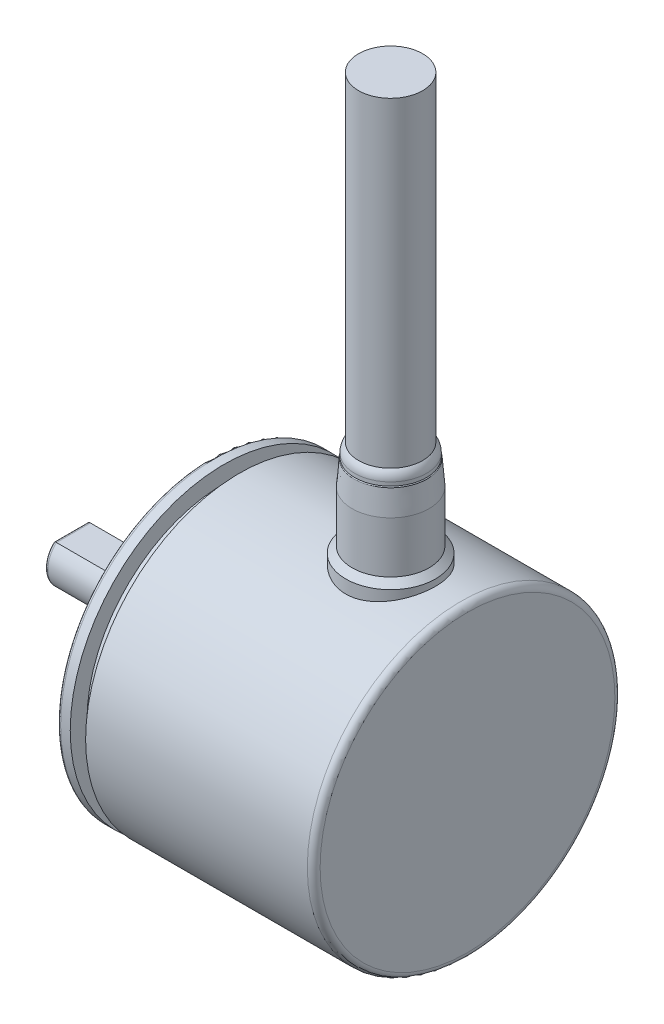
from build123d import *

# Parameters (mm, degrees)
ESQUISSE2_R             = 3.5
BOSS_EXTRU_1_DEPTH      = 13
ESQUISSE3_R             = 3
BOSS_EXTRU_2_DEPTH      = 6
ESQUISSE4_R             = 2.8
BOSS_EXTRU_3_DEPTH      = 1
ESQUISSE5_R             = 2.5
BOSS_EXTRU_4_DEPTH      = 25
CHANFREIN1_SIZE         = 0.5
CHANFREIN2_SIZE         = 2
CHANFREIN2_SIZE2        = 0.16
CONG_1_R                = 1
CONG_2_R                = 0.1
ENL_V_MAT_EXTRU_2_DEPTH = 8.5
CONG_3_R                = 0.5
CONG_4_R                = 0.25
CONG_5_R                = 0.25
ESQUISSE9_R             = 5
ESQUISSE9_R_2           = 4
ESQUISSE9_R_3           = 3
ESQUISSE9_R_4           = 2
ENL_V_MAT_EXTRU_4_DEPTH = 0.25
ESQUISSE10_R            = 4
ESQUISSE10_R_2          = 3
ENL_V_MAT_EXTRU_5_DEPTH = 0.5
CONG_6_R                = 0.125
ESQUISSE8_R             = 1.5
ENL_V_MAT_EXTRU_3_DEPTH = 6


# Some blends are built 0.0001 mm under size
with BuildPart() as part:
    # Esquisse1 → Révolution1 (revolve)
    with BuildSketch(Plane(origin=(0, 0, 0), x_dir=(1, 0, 0), z_dir=(0, 1, 0)), mode=Mode.PRIVATE) as r_volution1_sk:
        Polygon((12, 10.7), (12, 12), (11, 12), (11, 6), (10, 6), (10, 2), (0, 2), (0, 0), (31, 0), (31, 12), (13.2, 12), (13.2, 10.7), align=None)
    revolve(r_volution1_sk.sketch.rotate(Axis((0, 0, 0), (1, 0, 0)), 180), axis=Axis((0, 0, 0), (1, 0, 0)))

    # Esquisse2 → Boss.-Extru.1 (add)
    with BuildSketch(Plane(origin=(0, 0, 0), x_dir=(1, 0, 0), z_dir=(0, 1, 0))):
        with Locations(Location((25, 0, 0), (0, 0, 90))):
            Circle(ESQUISSE2_R)
    extrude(amount=BOSS_EXTRU_1_DEPTH)

    # Esquisse3 → Boss.-Extru.2 (add)
    with BuildSketch(Plane(origin=(0, 13, 0), x_dir=(1, 0, 0), z_dir=(0, 1, 0))):
        with Locations(Location((25, 0, 0), (0, 0, 270))):
            Circle(ESQUISSE3_R)
    extrude(amount=BOSS_EXTRU_2_DEPTH)

    # Esquisse4 → Boss.-Extru.3 (add)
    with BuildSketch(Plane(origin=(0, 19, 0), x_dir=(1, 0, 0), z_dir=(0, 1, 0))):
        with Locations(Location((25, 0, 0), (0, 0, 270))):
            Circle(ESQUISSE4_R)
    extrude(amount=BOSS_EXTRU_3_DEPTH)

    # Esquisse5 → Boss.-Extru.4 (add)
    with BuildSketch(Plane(origin=(0, 20, 0), x_dir=(1, 0, 0), z_dir=(0, 1, 0))):
        with Locations(Location((25, 0, 0), (0, 0, 270))):
            Circle(ESQUISSE5_R)
    extrude(amount=BOSS_EXTRU_4_DEPTH)

    # Chanfrein1
    chanfrein1_edges = [part.edges().sort_by_distance(p)[0] for p in [
        (25, 13, 3.5),
    ]]
    chamfer(chanfrein1_edges, length=CHANFREIN1_SIZE - 0.0001)  # a hair under: the kernel refuses the full size

    # Chanfrein2
    chanfrein2_edges = [part.edges().sort_by_distance(p)[0] for p in [
        (25, 19, -3),
    ]]
    chanfrein2_side = [part.faces().sort_by_distance(p)[0] for p in [
        (25, 16, -3),
    ]]
    chamfer(chanfrein2_edges, length=CHANFREIN2_SIZE, length2=CHANFREIN2_SIZE2, reference=chanfrein2_side[0])

    # Congé1
    # the kernel refuses this fillet: 1 mm, written as the material it takes off along each edge
    with BuildSketch(Plane(origin=(25, 20, 0), x_dir=(0, 0, 1), z_dir=(-1, 0, 0))) as cong_1_piece_1:
        with BuildLine():
            CenterArc((1.8, -0.714142843), CONG_1_R, 0, 45.572995999)
            Line((2.5, 0), (2.514, 0.014282857))
            ThreePointArc((2.514, 0.014282857), (2.65, 0.02), (2.8, 0.02))
            Line((2.8, 0.02), (2.82, 0))
            Line((2.82, 0), (2.82, -0.714142843))
            Line((2.82, -0.714142843), (2.8, -0.714142843))
        make_face()
    revolve(axis=Axis((25, 20, 0), (0, 1, 0)), mode=Mode.SUBTRACT)

    # Congé2
    # the kernel refuses this fillet: 0.1 mm, written as the material it takes off along each edge
    with BuildSketch(Plane(origin=(25, 19, 0), x_dir=(0, 0, 1), z_dir=(-1, 0, 0))) as cong_2_piece_1:
        with BuildLine():
            CenterArc((2.746436086, -0.084444699), CONG_2_R, 4.57392126, 53.038812221)
            Line((2.8, 0), (2.801071278, 0.001688894))
            ThreePointArc((2.801071278, 0.001688894), (2.82, 0.002), (2.84, 0.002))
            Line((2.84, 0.002), (2.841993631, 0.00015949))
            Line((2.841993631, 0.00015949), (2.848111245, -0.076310686))
            Line((2.848111245, -0.076310686), (2.846117614, -0.076470177))
        make_face()
    revolve(axis=Axis((25, 19, 0), (0, 1, 0)), mode=Mode.SUBTRACT)

    # Esquisse7 → Enlèv. mat.-Extru.2 (cut)
    with BuildSketch(Plane.ZY):
        with BuildLine():
            Line((-1.322875656, 1.5), (1.322875656, 1.5))
            ThreePointArc((1.322875656, 1.5), (0, 2), (-1.322875656, 1.5))
        make_face()
    extrude(amount=-ENL_V_MAT_EXTRU_2_DEPTH, mode=Mode.SUBTRACT)

    # Congé3
    cong_3_edges = [part.edges().sort_by_distance(p)[0] for p in [
        (31, 0, -12),
    ]]
    fillet(cong_3_edges, radius=CONG_3_R)

    # Congé4
    cong_4_edges = [part.edges().sort_by_distance(p)[0] for p in [
        (11, 0, -12),
        (10, 0, -6),
    ]]
    fillet(cong_4_edges, radius=CONG_4_R)

    # Congé5
    cong_5_edges = [part.edges().sort_by_distance(p)[0] for p in [
        (0, -1.822875656, -0.822875656),
        (0, 1.5, 0),
    ]]
    fillet(cong_5_edges, radius=CONG_5_R)

    # Esquisse9 → Enlèv. mat.-Extru.4 (cut)
    # profile 1 of 2: a face of its own
    with BuildSketch(Plane.ZY.offset(-10)):
        Circle(ESQUISSE9_R)
        Circle(ESQUISSE9_R_2, mode=Mode.SUBTRACT)
    # profile 2 of 2: a face of its own
    with BuildSketch(Plane.ZY.offset(-10)):
        Circle(ESQUISSE9_R_3)
        Circle(ESQUISSE9_R_4, mode=Mode.SUBTRACT)
    extrude(amount=-ENL_V_MAT_EXTRU_4_DEPTH, mode=Mode.SUBTRACT)

    # Esquisse10 → Enlèv. mat.-Extru.5 (cut)
    with BuildSketch(Plane.ZY.offset(-10)):
        Circle(ESQUISSE10_R)
        Circle(ESQUISSE10_R_2, mode=Mode.SUBTRACT)
    extrude(amount=-ENL_V_MAT_EXTRU_5_DEPTH, mode=Mode.SUBTRACT)

    # Congé6
    cong_6_edges = [part.edges().sort_by_distance(p)[0] for p in [
        (10.25, 0, -4),
        (10.25, 0, -3),
    ]]
    fillet(cong_6_edges, radius=CONG_6_R)

    # Esquisse8 → Enlèv. mat.-Extru.3 (cut)
    with BuildSketch(Plane.ZY.offset(-11)):
        with Locations((0, 9)):
            Circle(ESQUISSE8_R)
        with Locations((7.794228634, -4.5)):
            Circle(ESQUISSE8_R)
        with Locations((-7.794228634, -4.5)):
            Circle(ESQUISSE8_R)
    extrude(amount=-ENL_V_MAT_EXTRU_3_DEPTH, mode=Mode.SUBTRACT)


solid = part.part
